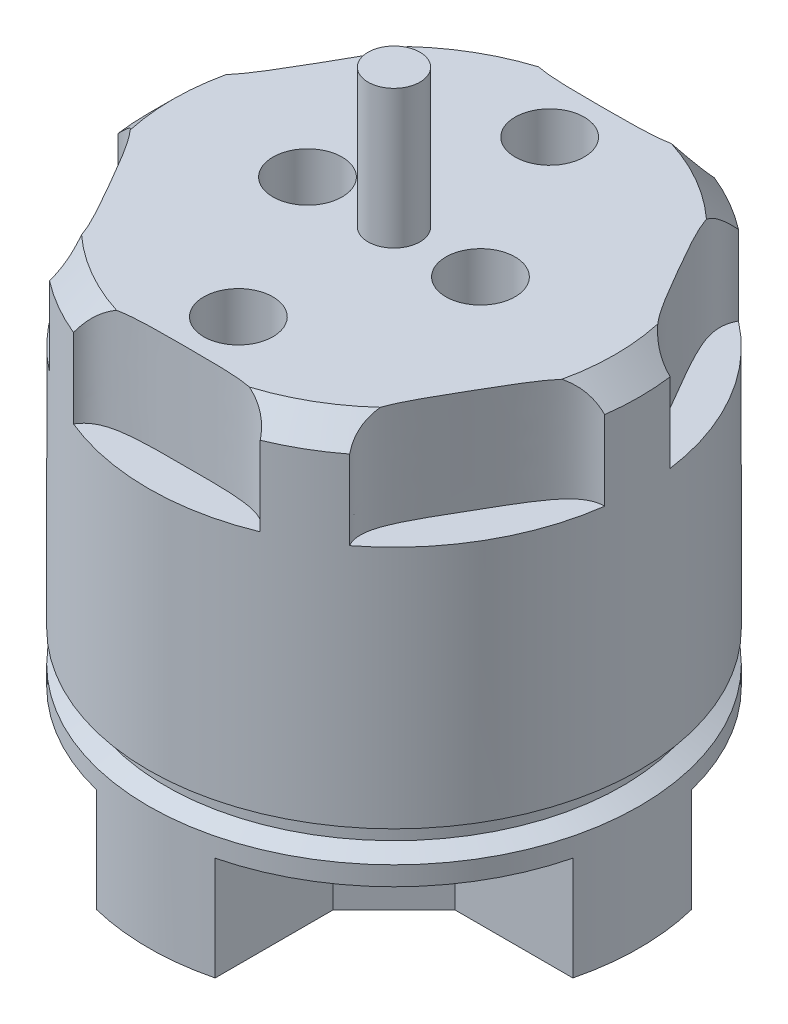
from build123d import *

# Parameters (mm, degrees)
SKETCH3_R          = 1
CUT_EXTRUDE1_DEPTH = 3
CUT_EXTRUDE2_START = -4
SKETCH4_R          = 1
CUT_EXTRUDE2_DEPTH = 4
CUT_EXTRUDE3_START = -3
CUT_EXTRUDE3_DEPTH = 3
CUT_EXTRUDE4_DEPTH = 3


with BuildPart() as part:
    # Sketch1 → Revolve1 (revolve)
    with BuildSketch(Plane(origin=(0, 0, 0), x_dir=(0, 0, -1), z_dir=(1, 0, 0))):
        Polygon((0, 18.5), (-0.75, 18.5), (-0.75, 14.5), (-6.392893219, 14.5), (-7.1, 13.792893219), (-7.1, 0), (-1, 0), (-1, -1), (0, -1), (0, 0), align=None)
    revolve(axis=Axis((0, 0, 0), (0, 1, 0)))

    # Sketch3 → Cut-Extrude1 (cut)
    with BuildSketch(Plane.XZ):
        with Locations((0, 4.5)):
            Circle(SKETCH3_R)
        with Locations((4.5, 0)):
            Circle(SKETCH3_R)
        with Locations((-4.5, 0)):
            Circle(SKETCH3_R)
        with Locations((0, -4.5)):
            Circle(SKETCH3_R)
    extrude(amount=-CUT_EXTRUDE1_DEPTH, mode=Mode.SUBTRACT)

    # Sketch4 → Cut-Extrude2 (cut)
    with BuildSketch(Plane(origin=(0, 14.5, 0), x_dir=(1, 0, 0), z_dir=(0, 1, 0)).offset(CUT_EXTRUDE2_START)):
        with Locations((0, 4.5)):
            Circle(SKETCH4_R)
        with Locations((2.5, 0)):
            Circle(SKETCH4_R)
        with Locations((0, -4.5)):
            Circle(SKETCH4_R)
        with Locations((-2.5, 0)):
            Circle(SKETCH4_R)
    extrude(amount=CUT_EXTRUDE2_DEPTH, mode=Mode.SUBTRACT)

    # Sketch5 → Cut-Extrude3 (cut)
    with BuildSketch(Plane(origin=(0, 14.5, 0), x_dir=(1, 0, 0), z_dir=(0, 1, 0)).offset(CUT_EXTRUDE3_START)):
        with BuildLine():
            ThreePointArc((-2.7, 6.566582064), (0, 7.1), (2.7, 6.566582064))
            add(Edge.make_bspline(
                [(-2.7, 6.566582064), (-2.071231518, 5.5), (0, 6.5), (2.071231518, 5.5), (2.7, 6.566582064)],
                knots=[0, 0, 0, 0, 0, 1, 1, 1, 1, 1], degree=4))
        make_face()
        with BuildLine():
            ThreePointArc((4.336826883, 5.621559622), (6.148780367, 3.55), (7.036826883, 0.945022442))
            add(Edge.make_bspline(
                [(4.336826883, 5.621559622), (3.727523962, 4.543739111), (5.629165125, 3.25), (5.79875548, 0.956260889), (7.036826883, 0.945022442)],
                knots=[0, 0, 0, 0, 0, 1, 1, 1, 1, 1], degree=4))
        make_face()
        with BuildLine():
            ThreePointArc((7.036826883, -0.945022442), (6.148780367, -3.55), (4.336826883, -5.621559622))
            add(Edge.make_bspline(
                [(7.036826883, -0.945022442), (5.79875548, -0.956260889), (5.629165125, -3.25), (3.727523962, -4.543739111), (4.336826883, -5.621559622)],
                knots=[0, 0, 0, 0, 0, 1, 1, 1, 1, 1], degree=4))
        make_face()
        with BuildLine():
            ThreePointArc((2.7, -6.566582064), (0, -7.1), (-2.7, -6.566582064))
            add(Edge.make_bspline(
                [(2.7, -6.566582064), (2.071231518, -5.5), (0, -6.5), (-2.071231518, -5.5), (-2.7, -6.566582064)],
                knots=[0, 0, 0, 0, 0, 1, 1, 1, 1, 1], degree=4))
        make_face()
        with BuildLine():
            ThreePointArc((-4.336826883, -5.621559622), (-6.148780367, -3.55), (-7.036826883, -0.945022442))
            add(Edge.make_bspline(
                [(-4.336826883, -5.621559622), (-3.727523962, -4.543739111), (-5.629165125, -3.25), (-5.79875548, -0.956260889), (-7.036826883, -0.945022442)],
                knots=[0, 0, 0, 0, 0, 1, 1, 1, 1, 1], degree=4))
        make_face()
        with BuildLine():
            ThreePointArc((-7.036826883, 0.945022442), (-6.148780367, 3.55), (-4.336826883, 5.621559622))
            add(Edge.make_bspline(
                [(-7.036826883, 0.945022442), (-5.79875548, 0.956260889), (-5.629165125, 3.25), (-3.727523962, 4.543739111), (-4.336826883, 5.621559622)],
                knots=[0, 0, 0, 0, 0, 1, 1, 1, 1, 1], degree=4))
        make_face()
    extrude(amount=CUT_EXTRUDE3_DEPTH, mode=Mode.SUBTRACT)

    # Sketch6 → Cut-Extrude4 (cut)
    with BuildSketch(Plane.XZ):
        with BuildLine():
            Line((-1.718410499, 6.888908866), (-1.718410499, 3.486177452))
            Line((-1.718410499, 3.486177452), (-3.486177452, 1.718410499))
            Line((-3.486177452, 1.718410499), (-6.888908866, 1.718410499))
            ThreePointArc((-6.888908866, 1.718410499), (-5.020458146, 5.020458146), (-1.718410499, 6.888908866))
        make_face()
        with BuildLine():
            Line((1.718410499, 3.486177452), (1.718410499, 6.888908866))
            ThreePointArc((1.718410499, 6.888908866), (5.020458146, 5.020458146), (6.888908866, 1.718410499))
            Line((6.888908866, 1.718410499), (3.486177452, 1.718410499))
            Line((3.486177452, 1.718410499), (1.718410499, 3.486177452))
        make_face()
        with BuildLine():
            Line((3.486177452, -1.718410499), (6.888908866, -1.718410499))
            ThreePointArc((6.888908866, -1.718410499), (5.020458146, -5.020458146), (1.718410499, -6.888908866))
            Line((1.718410499, -6.888908866), (1.718410499, -3.486177452))
            Line((1.718410499, -3.486177452), (3.486177452, -1.718410499))
        make_face()
        with BuildLine():
            Line((-1.718410499, -3.486177452), (-1.718410499, -6.888908866))
            ThreePointArc((-1.718410499, -6.888908866), (-5.020458146, -5.020458146), (-6.888908866, -1.718410499))
            Line((-6.888908866, -1.718410499), (-3.486177452, -1.718410499))
            Line((-3.486177452, -1.718410499), (-1.718410499, -3.486177452))
        make_face()
    extrude(amount=-CUT_EXTRUDE4_DEPTH, mode=Mode.SUBTRACT)

    # Sketch7 → Cut-Revolve1 (revolve, cut)
    with BuildSketch(Plane(origin=(0, 0, 0), x_dir=(0, 0, -1), z_dir=(1, 0, 0))):
        Polygon((-7.1, 3.55), (-6.6, 3.8), (-6.6, 4.2), (-7.1, 4.45), align=None)
    revolve(axis=Axis((0, 0, 0), (0, 1, 0)), mode=Mode.SUBTRACT)


solid = part.part
